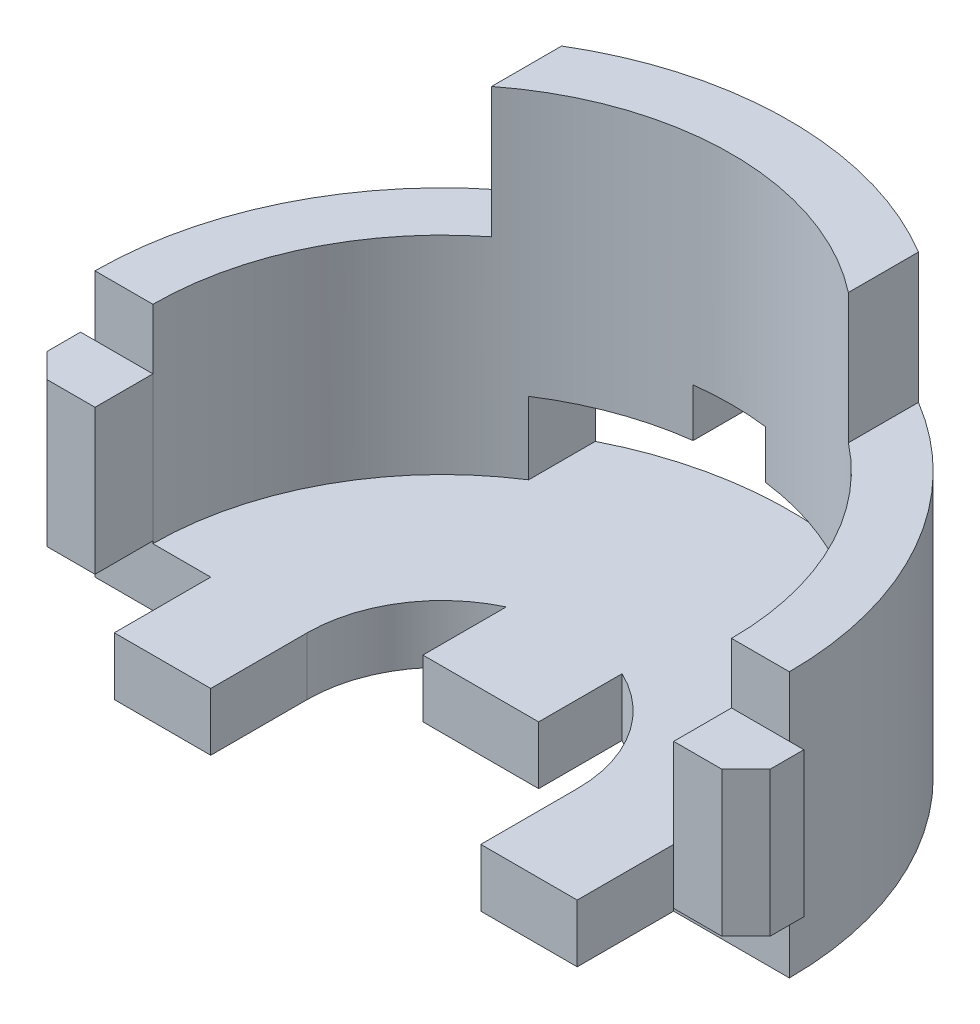
from build123d import *

# Parameters (mm, degrees)
SKETCH1_W                = 6
SKETCH1_H                = 1.2
SKETCH1_W_2              = 1.2
SKETCH1_H_2              = 4.3
REVOLVE1_ANGLE           = 180
REVOLVE2_START           = 4.3
REVOLVE2_DEPTH           = 2.7
CUT_EXTRUDE1_DEPTH       = 10
CUT_EXTRUDE2_DEPTH       = 10
SKETCH5_W                = 2
SKETCH5_H                = 2
BOSS_EXTRUDE1_DEPTH      = 1.2
SKETCH6_W                = 1.2
SKETCH6_H                = 3
BOSS_EXTRUDE2_DEPTH      = 1.5
CHAMFER1_SIZE            = 0.5
CHAMFER1_OF_MIRROR1_SIZE = 0.5


# Read off the part's stored shape, not the designer's step: Revolve2
with BuildPart() as part:
    # Sketch1 → Revolve1 (revolve)
    with BuildSketch(Plane.XY):
        with Locations((3, -0.6)):
            Rectangle(SKETCH1_W, SKETCH1_H)
        with Locations((6.6, -0.6)):
            Rectangle(SKETCH1_W_2, SKETCH1_H)
        with Locations((6.6, 2.15)):
            Rectangle(SKETCH1_W_2, SKETCH1_H_2)
    revolve(axis=Axis((0, -1.2, 0), (0, 1, 0)), revolution_arc=REVOLVE1_ANGLE)

    # Revolve2 outline → Revolve2 (add)
    with BuildSketch(Plane(origin=(0, 0, 0), x_dir=(1, 0, 0), z_dir=(0, 1, 0)).offset(REVOLVE2_START)):
        with BuildLine():
            ThreePointArc((3.7, 6.176568627), (0, 7.2), (-3.7, 6.176568627))
            Line((-3.7, 6.176568627), (-3.7, 4.723346271))
            ThreePointArc((-3.7, 4.723346271), (0, 6), (3.7, 4.723346271))
            Line((3.7, 4.723346271), (3.7, 6.176568627))
        make_face()
    extrude(amount=REVOLVE2_DEPTH)

    # Sketch3 → Cut-Extrude1 (cut)
    with BuildSketch(Plane.XY):
        Polygon((-3.25, 1.5), (-0.75, 1.5), (-0.75, 2.5), (0.75, 2.5), (0.75, 1.5), (3.25, 1.5), (3.25, 0), (-3.25, 0), align=None)
    extrude(amount=-CUT_EXTRUDE1_DEPTH, mode=Mode.SUBTRACT)

    # Sketch4 → Cut-Extrude2 (cut)
    with BuildSketch(Plane(origin=(0, 0, 0), x_dir=(1, 0, 0), z_dir=(0, 1, 0))):
        with BuildLine():
            Line((-1.2, 0.8), (-1.2, 2.529822128))
            ThreePointArc((-1.2, 2.529822128), (-2.366431913, 1.496662955), (-2.8, 0))
            Line((-2.8, 0), (2.8, 0))
            ThreePointArc((2.8, 0), (2.366431913, 1.496662955), (1.2, 2.529822128))
            Line((1.2, 2.529822128), (1.2, 0.8))
            Line((1.2, 0.8), (-1.2, 0.8))
        make_face()
    extrude(amount=-CUT_EXTRUDE2_DEPTH, mode=Mode.SUBTRACT)

    # Sketch5 → Boss-Extrude1 (add)
    with BuildSketch(Plane(origin=(0, 0, 0), x_dir=(1, 0, 0), z_dir=(0, 1, 0))):
        with Locations((-3.8, -1)):
            Rectangle(SKETCH5_W, SKETCH5_H)
        with Locations((3.8, -1)):
            Rectangle(SKETCH5_W, SKETCH5_H)
    extrude(amount=-BOSS_EXTRUDE1_DEPTH)

    # Sketch6 → Boss-Extrude2 (add)
    with BuildSketch(Plane(origin=(6, 0, 0), x_dir=(0, 0, -1), z_dir=(1, 0, 0))):
        with Locations((-0.6, 1.55)):
            Rectangle(SKETCH6_W, SKETCH6_H)
    boss_extrude2 = extrude(amount=BOSS_EXTRUDE2_DEPTH)

    # Chamfer1
    chamfer1_edges = [part.edges().sort_by_distance(p)[0] for p in [
        (7.5, 1.55, 1.2),
    ]]
    chamfer(chamfer1_edges, length=CHAMFER1_SIZE)

    # Mirror1: Boss-Extrude2 across plane
    add(boss_extrude2.mirror(Plane(origin=(0, 0, 0), x_dir=(0, 0, 1), z_dir=(1, 0, 0))))

    # Chamfer1 of Mirror1
    chamfer1_of_mirror1_edges = [part.edges().sort_by_distance(p)[0] for p in [
        (-7.5, 1.55, 1.2),
    ]]
    chamfer(chamfer1_of_mirror1_edges, length=CHAMFER1_OF_MIRROR1_SIZE)


solid = part.part
